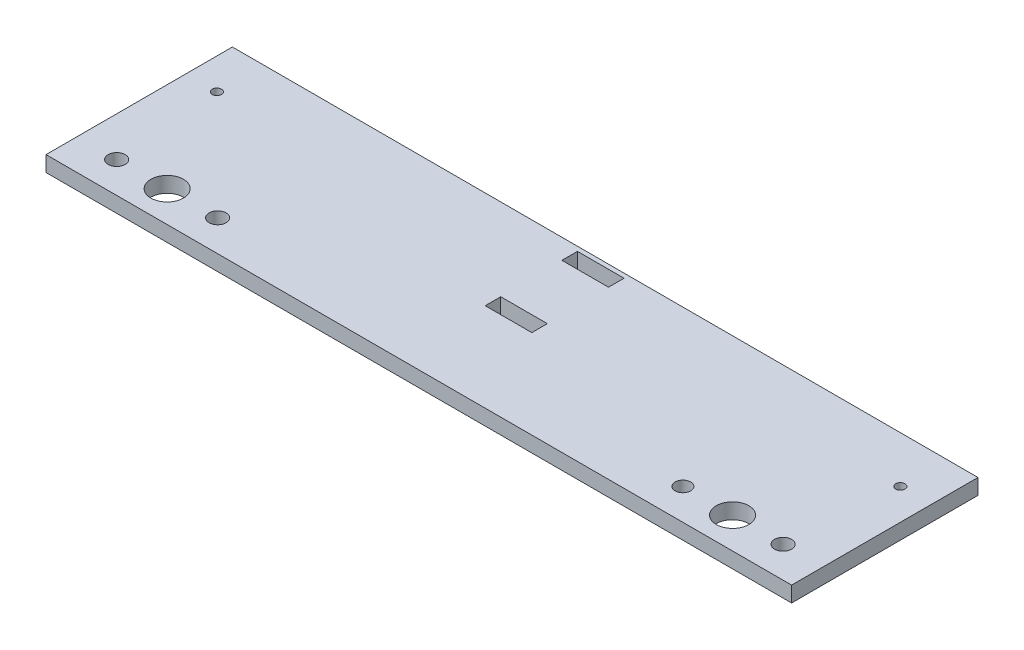
from build123d import *

# Parameters (mm, degrees)
SKETCH1_W           = 240
SKETCH1_H           = 60
SKETCH1_R           = 5.248248104
SKETCH1_R_2         = 1.5
SKETCH1_R_3         = 2.75
SKETCH1_R_4         = 2.5
SKETCH1_W_2         = 15
SKETCH1_H_2         = 5
BOSS_EXTRUDE1_DEPTH = 5


with BuildPart() as part:
    # Sketch1 → Boss-Extrude1 (new body)
    with BuildSketch(Plane(origin=(0, 0, 0), x_dir=(1, 0, 0), z_dir=(0, 1, 0))):
        with Locations((0, -15.214636322)):
            Rectangle(SKETCH1_W, SKETCH1_H)
        with Locations((-91, -35.214636322)):
            Circle(SKETCH1_R, mode=Mode.SUBTRACT)
        with Locations((91, -35.214636322)):
            Circle(SKETCH1_R, mode=Mode.SUBTRACT)
        with Locations((-110, -0.214636322)):
            Circle(SKETCH1_R_2, mode=Mode.SUBTRACT)
        with Locations((110, -0.214636322)):
            Circle(SKETCH1_R_2, mode=Mode.SUBTRACT)
        with Locations((-74.75, -35.214636322)):
            Circle(SKETCH1_R_3, mode=Mode.SUBTRACT)
        with Locations((-107.25, -35.214636322)):
            Circle(SKETCH1_R_3, mode=Mode.SUBTRACT)
        with Locations((107.25, -35.214636322)):
            Circle(SKETCH1_R_3, mode=Mode.SUBTRACT)
        with Locations((75, -35.214636322)):
            Circle(SKETCH1_R_4, mode=Mode.SUBTRACT)
        with Locations((0.310691637, -14.147905604)):
            Rectangle(SKETCH1_W_2, SKETCH1_H_2, mode=Mode.SUBTRACT)
        with Locations((0, 10.852094396)):
            Rectangle(SKETCH1_W_2, SKETCH1_H_2, mode=Mode.SUBTRACT)
    extrude(amount=BOSS_EXTRUDE1_DEPTH)


solid = part.part
